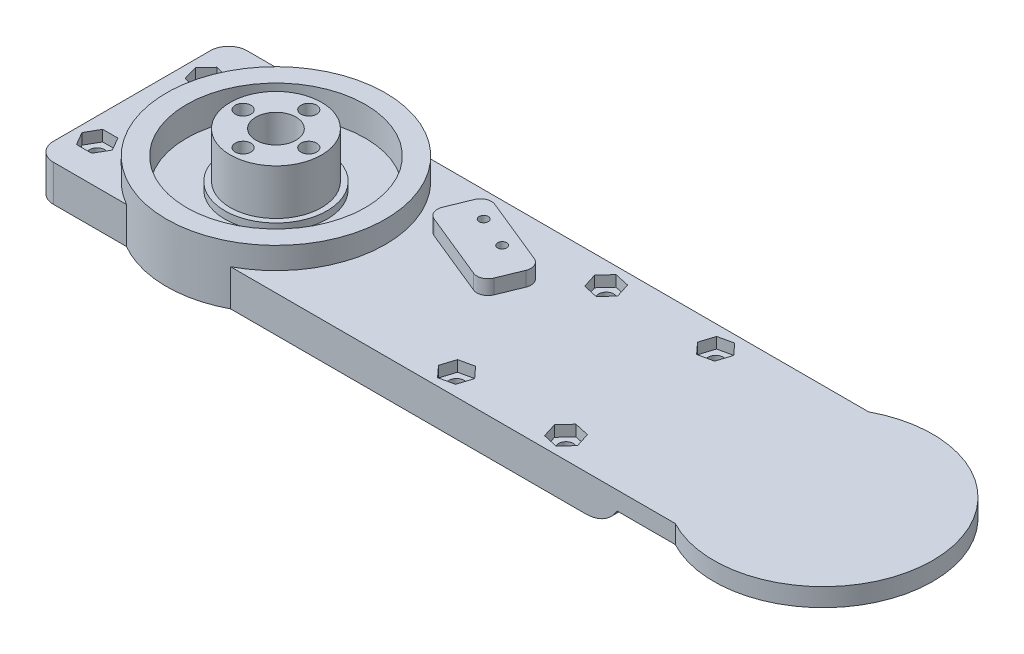
from build123d import *
from build123d.topology import SkipClean

# Parameters (mm, degrees)
BOSS_EXTRUDE1_DEPTH = 10
SKETCH2_R           = 30
BOSS_EXTRUDE2_DEPTH = 6
SKETCH3_R           = 24.5
CUT_EXTRUDE1_DEPTH  = 8
SKETCH4_R           = 14
BOSS_EXTRUDE3_DEPTH = 2
SKETCH5_R           = 12.5
BOSS_EXTRUDE4_DEPTH = 12.5
SKETCH6_R           = 2.15
CUT_EXTRUDE2_DEPTH  = 112.495515605
SKETCH9_W           = 28.658691477
SKETCH9_H           = 53
BOSS_EXTRUDE5_DEPTH = 10
FILLET1_R           = 5
BOSS_EXTRUDE6_DEPTH = 4
CUT_EXTRUDE7_REACH  = 121.67
SKETCH14_R          = 1.25
FILLET2_R           = 3
CUT_EXTRUDE11_REACH = 122.96
SKETCH16_R          = 5.5
SKETCH17_R          = 24.5
SKETCH17_R_2        = 14
CUT_EXTRUDE13_DEPTH = 10
CUT_EXTRUDE14_REACH = 122.96
SKETCH18_R          = 2.05
CUT_EXTRUDE15_DEPTH = 3
CUT_EXTRUDE16_REACH = 121.504
SKETCH20_R          = 2.05
CUT_EXTRUDE17_DEPTH = 3
SKETCH22_W          = 60
SKETCH22_H          = 87.954207694
CUT_EXTRUDE18_DEPTH = 5
FILLET3_R           = 10
SKETCH23_W          = 11.689767446
SKETCH23_H          = 4
BOSS_EXTRUDE7_DEPTH = 5
SKETCH24_W          = 11.689767446
SKETCH24_H          = 2
BOSS_EXTRUDE8_DEPTH = 8
RIB1_REACH          = 180.338
SKETCH25_WALL_W     = 365.746672076
SKETCH25_WALL_H     = 11.5


with BuildPart() as part:
    # Sketch1 → Boss-Extrude1 (new body)
    with BuildSketch(Plane(origin=(0, 0, 0), x_dir=(1, 0, 0), z_dir=(0, 1, 0))):
        with BuildLine():
            Line((-60.93763889, 26.5), (60.93763889, 26.5))
            ThreePointArc((60.93763889, 26.5), (105, 0), (60.93763889, -26.5))
            Line((60.93763889, -26.5), (-60.93763889, -26.5))
            ThreePointArc((-60.93763889, -26.5), (-105, 0), (-60.93763889, 26.5))
        make_face()
    extrude(amount=BOSS_EXTRUDE1_DEPTH)

    # Sketch2 → Boss-Extrude2 (add)
    with SkipClean():  # the faces are left unmerged after this step: merging them gives an invalid solid
        with BuildSketch(Plane(origin=(0, 10, 0), x_dir=(1, 0, 0), z_dir=(0, 1, 0))):
            with Locations(Location((-75, 0, 0), (0, 0, 62.047113411))):
                Circle(SKETCH2_R)
        extrude(amount=BOSS_EXTRUDE2_DEPTH)

    # Sketch3 → Cut-Extrude1 (cut)
    with SkipClean():  # the faces are left unmerged after this step: merging them gives an invalid solid
        with BuildSketch(Plane(origin=(0, 16, 0), x_dir=(1, 0, 0), z_dir=(0, 1, 0))):
            with Locations(Location((-75, 0, 0), (0, 0, 270))):
                Circle(SKETCH3_R)
        extrude(amount=-CUT_EXTRUDE1_DEPTH, mode=Mode.SUBTRACT)

    # Sketch4 → Boss-Extrude3 (add)
    with SkipClean():  # the faces are left unmerged after this step: merging them gives an invalid solid
        with BuildSketch(Plane(origin=(0, 8, 0), x_dir=(1, 0, 0), z_dir=(0, 1, 0))):
            with Locations(Location((-75, 0, 0), (0, 0, 270))):
                Circle(SKETCH4_R)
        extrude(amount=BOSS_EXTRUDE3_DEPTH)

    # Sketch5 → Boss-Extrude4 (add)
    with SkipClean():  # the faces are left unmerged after this step: merging them gives an invalid solid
        with BuildSketch(Plane(origin=(0, 10, 0), x_dir=(1, 0, 0), z_dir=(0, 1, 0))):
            with Locations(Location((-75, 0, 0), (0, 0, 270))):
                Circle(SKETCH5_R)
        extrude(amount=BOSS_EXTRUDE4_DEPTH)

    # Sketch6 → Cut-Extrude2 (cut, through all)
    with SkipClean():  # the faces are left unmerged after this step: merging them gives an invalid solid
        with BuildSketch(Plane(origin=(0, 22.5, 0), x_dir=(1, 0, 0), z_dir=(0, 1, 0))):
            with Locations(Location((-75, 9, 0), (0, 0, 270))):
                Circle(SKETCH6_R)
            with Locations(Location((-66, 0, 0), (0, 0, 270))):
                Circle(SKETCH6_R)
            with Locations(Location((-75, -9, 0), (0, 0, 270))):
                Circle(SKETCH6_R)
            with Locations(Location((-84, 0, 0), (0, 0, 270))):
                Circle(SKETCH6_R)
        extrude(amount=-CUT_EXTRUDE2_DEPTH, mode=Mode.SUBTRACT)

    # Sketch9 → Boss-Extrude5 (add)
    with SkipClean():  # the faces are left unmerged after this step: merging them gives an invalid solid
        with BuildSketch(Plane.XZ):
            with Locations((-100.670654262, -0.534084338)):
                Rectangle(SKETCH9_W, SKETCH9_H)
        extrude(amount=-BOSS_EXTRUDE5_DEPTH)

    # Fillet1
    fillet1_edges = [part.edges().sort_by_distance(p)[0] for p in [
        (-115, 5, 25.965915662),
        (-115, 5, -27.034084338),
    ]]
    fillet(fillet1_edges, radius=FILLET1_R)

    # Sketch12 → Boss-Extrude6 (add)
    with SkipClean():  # the faces are left unmerged after this step: merging them gives an invalid solid
        with BuildSketch(Plane(origin=(0, 10, 0), x_dir=(1, 0, 0), z_dir=(0, 1, 0))):
            Polygon((-43.16666424, 9.875580331), (-38.350700506, 21.672026177), (-14.488649274, 11.930212849), (-19.304613009, 0.133767003), align=None)
        extrude(amount=BOSS_EXTRUDE6_DEPTH)

    # Sketch14 → Cut-Extrude7 (cut, up to next)
    with BuildSketch(Plane(origin=(0, 14, 0), x_dir=(1, 0, 0), z_dir=(0, 1, 0)), mode=Mode.PRIVATE) as cut_extrude7_sk1:
        with Locations(Location((-33.564174503, 15.494361153, 0), (0, 0, 270))):
            Circle(SKETCH14_R)
    cut_extrude7_tool1 = extrude(cut_extrude7_sk1.sketch, amount=-CUT_EXTRUDE7_REACH, mode=Mode.PRIVATE) & part.part
    # Sketch14 → Cut-Extrude7 (cut, up to next)
    with BuildSketch(Plane(origin=(0, 14, 0), x_dir=(1, 0, 0), z_dir=(0, 1, 0)), mode=Mode.PRIVATE) as cut_extrude7_sk2:
        with Locations(Location((-24.810172553, 11.804178248, 0), (0, 0, 270))):
            Circle(SKETCH14_R)
    cut_extrude7_tool2 = extrude(cut_extrude7_sk2.sketch, amount=-CUT_EXTRUDE7_REACH, mode=Mode.PRIVATE) & part.part
    add(cut_extrude7_tool1.solids().sort_by_distance((-33.564175, 14, -15.494361))[0], mode=Mode.SUBTRACT)
    add(cut_extrude7_tool2.solids().sort_by_distance((-24.810173, 14, -11.804178))[0], mode=Mode.SUBTRACT)

    # Fillet2
    fillet2_edges = [part.edges().sort_by_distance(p)[0] for p in [
        (-43.16666424, 12, -9.875580331),
        (-19.304613009, 12, -0.133767003),
        (-14.488649274, 12, -11.930212849),
        (-38.350700506, 12, -21.672026177),
    ]]
    fillet(fillet2_edges, radius=FILLET2_R)

    # Sketch16 → Cut-Extrude11 (cut, up to next)
    with BuildSketch(Plane(origin=(0, 22.5, 0), x_dir=(1, 0, 0), z_dir=(0, 1, 0)), mode=Mode.PRIVATE) as cut_extrude11_sk1:
        with Locations(Location((-75, 0, 0), (0, 0, 270))):
            Circle(SKETCH16_R)
    cut_extrude11_tool1 = extrude(cut_extrude11_sk1.sketch, amount=-CUT_EXTRUDE11_REACH, mode=Mode.PRIVATE) & part.part
    add(cut_extrude11_tool1.solids().sort_by_distance((-75, 22.5, 0))[0], mode=Mode.SUBTRACT)

    # Sketch17 → Cut-Extrude13 (cut)
    with SkipClean():  # the faces are left unmerged after this step: merging them gives an invalid solid
        with BuildSketch(Plane(origin=(0, 8, 0), x_dir=(1, 0, 0), z_dir=(0, 1, 0))):
            with Locations(Location((-75, 0, 0), (0, 0, 270))):
                Circle(SKETCH17_R)
            with Locations(Location((-75, 0, 0), (0, 0, 270))):
                Circle(SKETCH17_R_2, mode=Mode.SUBTRACT)
        extrude(amount=CUT_EXTRUDE13_DEPTH, mode=Mode.SUBTRACT)

    # Sketch18 → Cut-Extrude14 (cut, up to next)
    with BuildSketch(Plane.XZ, mode=Mode.PRIVATE) as cut_extrude14_sk1:
        with Locations(Location((-5, -20.5, 0), (0, 0, 270))):
            Circle(SKETCH18_R)
    cut_extrude14_tool1 = extrude(cut_extrude14_sk1.sketch, amount=-CUT_EXTRUDE14_REACH, mode=Mode.PRIVATE) & part.part
    # Sketch18 → Cut-Extrude14 (cut, up to next)
    with BuildSketch(Plane.XZ, mode=Mode.PRIVATE) as cut_extrude14_sk2:
        with Locations(Location((25, -20.5, 0), (0, 0, 270))):
            Circle(SKETCH18_R)
    cut_extrude14_tool2 = extrude(cut_extrude14_sk2.sketch, amount=-CUT_EXTRUDE14_REACH, mode=Mode.PRIVATE) & part.part
    cut_extrude14_1 = cut_extrude14_tool1.solids().sort_by_distance((-5, 0, -20.5))[0]
    add(cut_extrude14_1, mode=Mode.SUBTRACT)
    cut_extrude14_2 = cut_extrude14_tool2.solids().sort_by_distance((25, 0, -20.5))[0]
    add(cut_extrude14_2, mode=Mode.SUBTRACT)
    cut_extrude14 = cut_extrude14_1 + cut_extrude14_2  # Cut-Extrude14 as one shape, for the pattern or mirror that repeats it

    # Sketch19 → Cut-Extrude15 (cut)
    with SkipClean():  # the faces are left unmerged after this step: merging them gives an invalid solid
        with BuildSketch(Plane(origin=(0, 10, 0), x_dir=(1, 0, 0), z_dir=(0, 1, 0))):
            Polygon((-3.750049294, 16.535454221), (-0.941627288, 19.600216175), (-2.191577994, 23.564761954), (-6.249950706, 24.464545779), (-9.058372712, 21.399783825), (-7.808422006, 17.435238046), align=None)
            Polygon((23.750049294, 16.535454221), (27.808422006, 17.435238046), (29.058372712, 21.399783825), (26.249950706, 24.464545779), (22.191577994, 23.564761954), (20.941627288, 19.600216175), align=None)
        cut_extrude15 = extrude(amount=-CUT_EXTRUDE15_DEPTH, mode=Mode.SUBTRACT)

    # Mirror1: Cut-Extrude14, Cut-Extrude15 across plane
    with SkipClean():  # the faces are left unmerged after this step: merging them gives an invalid solid
        add(cut_extrude14.mirror(Plane.XY), mode=Mode.SUBTRACT)
        add(cut_extrude15.mirror(Plane.XY), mode=Mode.SUBTRACT)

    # Sketch20 → Cut-Extrude16 (cut, up to next)
    with BuildSketch(Plane(origin=(0, 10, 0), x_dir=(1, 0, 0), z_dir=(0, 1, 0)), mode=Mode.PRIVATE) as cut_extrude16_sk1:
        with Locations(Location((-109, 15, 0), (0, 0, 270))):
            Circle(SKETCH20_R)
    cut_extrude16_tool1 = extrude(cut_extrude16_sk1.sketch, amount=-CUT_EXTRUDE16_REACH, mode=Mode.PRIVATE) & part.part
    # Sketch20 → Cut-Extrude16 (cut, up to next)
    with BuildSketch(Plane(origin=(0, 10, 0), x_dir=(1, 0, 0), z_dir=(0, 1, 0)), mode=Mode.PRIVATE) as cut_extrude16_sk2:
        with Locations(Location((-109, -15, 0), (0, 0, 270))):
            Circle(SKETCH20_R)
    cut_extrude16_tool2 = extrude(cut_extrude16_sk2.sketch, amount=-CUT_EXTRUDE16_REACH, mode=Mode.PRIVATE) & part.part
    add(cut_extrude16_tool1.solids().sort_by_distance((-109, 10, -15))[0], mode=Mode.SUBTRACT)
    add(cut_extrude16_tool2.solids().sort_by_distance((-109, 10, 15))[0], mode=Mode.SUBTRACT)

    # Sketch21 → Cut-Extrude17 (cut)
    with SkipClean():  # the faces are left unmerged after this step: merging them gives an invalid solid
        with BuildSketch(Plane(origin=(0, 10, 0), x_dir=(1, 0, 0), z_dir=(0, 1, 0))):
            Polygon((-107.839689916, 11.008298545), (-104.962930093, 14.009007281), (-106.123240177, 18.000708737), (-110.160310084, 18.991701455), (-113.037069907, 15.990992719), (-111.876759823, 11.999291263), align=None)
            Polygon((-113.156921938, -15), (-111.078460969, -18.6), (-106.921539031, -18.6), (-104.843078062, -15), (-106.921539031, -11.4), (-111.078460969, -11.4), align=None)
        extrude(amount=-CUT_EXTRUDE17_DEPTH, mode=Mode.SUBTRACT)

    # Sketch22 → Cut-Extrude18 (cut)
    with SkipClean():  # the faces are left unmerged after this step: merging them gives an invalid solid
        with BuildSketch(Plane.XZ):
            with Locations((75, 0)):
                Rectangle(SKETCH22_W, SKETCH22_H)
        extrude(amount=-CUT_EXTRUDE18_DEPTH, mode=Mode.SUBTRACT)

    # Fillet3
    # the kernel refuses this fillet: 10 mm, written as the material it takes off along each edge
    with BuildSketch(Plane(origin=(45, 0, -48.150635095), x_dir=(0, 1, 0), z_dir=(0, 0, 1))) as fillet3_piece_1:
        with BuildLine():
            CenterArc((10, 8.660254038), FILLET3_R, 180, 60)
            Line((0, 8.660254038), (-0.2, 8.660254038))
            Line((-0.2, 8.660254038), (-0.2, 0))
            Line((-0.2, 0), (0, -0.2))
            ThreePointArc((0, -0.2), (2.5, -0.2), (4.9, -0.173205081))
            Line((4.9, -0.173205081), (5, 0))
        make_face()
    extrude(amount=96.301270189, mode=Mode.SUBTRACT)

    # Sketch23 → Boss-Extrude7 (add)
    with BuildSketch(Plane.XZ.offset(-5)):
        with Locations((53.505687453, 8.93083443)):
            Rectangle(SKETCH23_W, SKETCH23_H)
    extrude(amount=BOSS_EXTRUDE7_DEPTH)

    # Sketch24 → Boss-Extrude8 (add)
    with BuildSketch(Plane.XY.offset(10.93083443)):
        with Locations((53.505687453, 1)):
            Rectangle(SKETCH24_W, SKETCH24_H)
    extrude(amount=BOSS_EXTRUDE8_DEPTH)

    # Sketch25 wall → Rib1 (add, up to next)
    with BuildSketch(Plane(origin=(59.350571176, 2.5, 4.43083443), x_dir=(0, 0.707106781187, -0.707106781187), z_dir=(0, 0.707106781187, 0.707106781187)), mode=Mode.PRIVATE) as rib1_sk1:
        with Locations((0, 5.75)):
            Rectangle(SKETCH25_WALL_W, SKETCH25_WALL_H)
    rib1_tool1 = extrude(rib1_sk1.sketch, amount=RIB1_REACH, mode=Mode.PRIVATE) - part.part
    add(rib1_tool1.solids().sort_by_distance((59.350571176, 2.5, 4.43083443))[0])


solid = part.part
